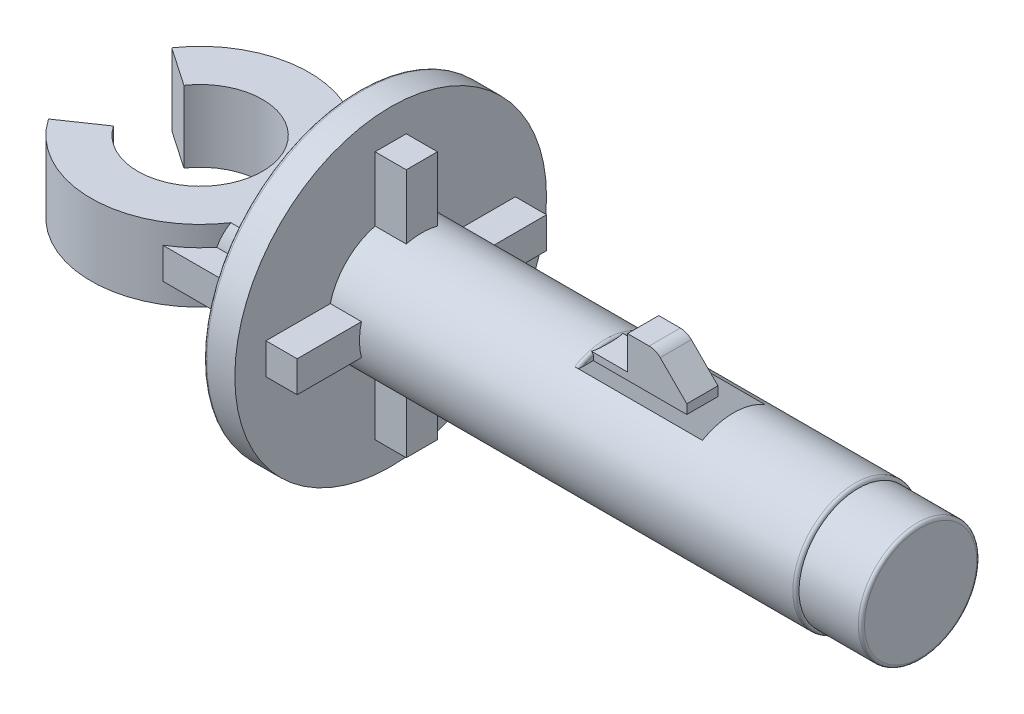
from build123d import *

# Parameters (mm, degrees)
SCHIZZO1_R                    = 2
ESTRUSIONE_ESTRUSIONE1_DEPTH  = 17
SCHIZZO2_OUTSIDE_W            = 9.584
SCHIZZO2_OUTSIDE_H            = 9.584
SCHIZZO2_OUTSIDE_R            = 1.9
TAGLIO_ESTRUSIONE1_DEPTH      = 2
SCHIZZO6_W                    = 15
SCHIZZO6_H                    = 4
TAGLIO_ESTRUSIONE3_DEPTH      = 0.1
TAGLIO_ESTRUSIONE4_DEPTH      = 1.7
TAGLIO_ESTRUSIONE4_DEPTH_BACK = 18.23368794
SCHIZZO5_W                    = 13
SCHIZZO5_H                    = 2
SCHIZZO7_W                    = 4
SCHIZZO7_H                    = 2
TAGLIO_ESTRUSIONE5_DEPTH      = 18.555910686
ESTRUSIONE_ESTRUSIONE2_DEPTH  = 0.5
TAGLIO_ESTRUSIONE6_DEPTH      = 0.07
ESTRUSIONE_ESTRUSIONE4_DEPTH  = 0.5
ESTRUSIONE_ESTRUSIONE5_DEPTH  = 0.5
SCHIZZO20_R                   = 5
ESTRUSIONE_ESTRUSIONE6_DEPTH  = 1
SCHIZZO23_R                   = 2.25
ESTRUSIONE_ESTRUSIONE7_DEPTH  = 3
ESTRUSIONE_ESTRUSIONE10_DEPTH = 1.15
ESTRUSIONE_ESTRUSIONE8_DEPTH  = 0.5
SCHIZZO35_W                   = 3
SCHIZZO35_H                   = 3.867815922
TAGLIO_ESTRUSIONE7_DEPTH      = 1.3
RACCORDO22_R                  = 0.5
RACCORDO23_R                  = 0.1
RACCORDO24_R                  = 0.1
RACCORDO25_R                  = 0.1
RACCORDO28_R                  = 0.1


# Some blends are built 0.0001 mm under size
with BuildPart() as part:
    # Schizzo1 → Estrusione-Estrusione1 (new body)
    with BuildSketch(Plane(origin=(0, 0, 0), x_dir=(0, 0, -1), z_dir=(1, 0, 0))):
        Circle(SCHIZZO1_R)
    extrude(amount=-ESTRUSIONE_ESTRUSIONE1_DEPTH)

    # Schizzo2 outside → Taglio-Estrusione1 (cut)
    with BuildSketch(Plane(origin=(0, 0, 0), x_dir=(0, 0, -1), z_dir=(1, 0, 0))):
        Rectangle(SCHIZZO2_OUTSIDE_W, SCHIZZO2_OUTSIDE_H)
        Circle(SCHIZZO2_OUTSIDE_R, mode=Mode.SUBTRACT)
    extrude(amount=-TAGLIO_ESTRUSIONE1_DEPTH, mode=Mode.SUBTRACT)

    # Schizzo6 → Taglio-Estrusione3 (cut)
    with BuildSketch(Plane(origin=(0, -2, 0), x_dir=(-1, 0, 0), z_dir=(0, -1, 0))):
        with Locations((9.5, 0)):
            Rectangle(SCHIZZO6_W, SCHIZZO6_H)
    extrude(amount=-TAGLIO_ESTRUSIONE3_DEPTH, mode=Mode.SUBTRACT)

    # Schizzo5 → Taglio-Estrusione4 (cut, two sides: drawn at the far end of the back side and taken through both)
    with BuildSketch(Plane(origin=(0, 0, 0), x_dir=(1, 0, 0), z_dir=(0, 1, 0)).offset(-TAGLIO_ESTRUSIONE4_DEPTH_BACK)):
        with Locations((-9.5, 0)):
            Rectangle(SCHIZZO5_W, SCHIZZO5_H)
    extrude(amount=TAGLIO_ESTRUSIONE4_DEPTH + TAGLIO_ESTRUSIONE4_DEPTH_BACK, mode=Mode.SUBTRACT)

    # Schizzo7 → Taglio-Estrusione5 (cut, through all)
    with BuildSketch(Plane(origin=(0, 2, 0), x_dir=(1, 0, 0), z_dir=(0, 1, 0))):
        with Locations((-8, 0)):
            Rectangle(SCHIZZO7_W, SCHIZZO7_H)
    extrude(amount=-TAGLIO_ESTRUSIONE5_DEPTH, mode=Mode.SUBTRACT)

    # Schizzo12 → Estrusione-Estrusione2 (add, symmetric)
    with BuildSketch(Plane.XY):
        Polygon((-10, 2), (-8.9, 2), (-8.9, 3), (-8, 3), (-7, 2), (-7, 1.7), (-10, 1.7), align=None)
    extrude(amount=ESTRUSIONE_ESTRUSIONE2_DEPTH, both=True)

    # Schizzo16 → Taglio-Estrusione6 (cut)
    with BuildSketch(Plane(origin=(0, 2, 0), x_dir=(1, 0, 0), z_dir=(0, 1, 0))):
        Polygon((-8.9, 0.5), (-10, 0.5), (-10, 0), (-10, -0.5), (-8.9, -0.5), align=None)
    extrude(amount=-TAGLIO_ESTRUSIONE6_DEPTH, mode=Mode.SUBTRACT)

    # Schizzo17 → Estrusione-Estrusione4 (add, symmetric)
    with BuildSketch(Plane.XY):
        Polygon((-17, 4), (-16, 4), (-16, 0.047058824), (-17, 0.05), align=None)
    estrusione_estrusione4 = extrude(amount=ESTRUSIONE_ESTRUSIONE4_DEPTH, both=True)

    # Specchia2: Estrusione-Estrusione4 across plane
    add(estrusione_estrusione4.mirror(Plane.ZX))

    # Schizzo19 → Estrusione-Estrusione5 (add, symmetric)
    with BuildSketch(Plane(origin=(0, 0, 0), x_dir=(1, 0, 0), z_dir=(0, 1, 0))):
        Polygon((-17, 2), (-17, 0), (-16, 0), (-16, 2), (-16, 4), (-17, 4), align=None)
    estrusione_estrusione5 = extrude(amount=ESTRUSIONE_ESTRUSIONE5_DEPTH, both=True)

    # Specchia5: Estrusione-Estrusione5 across plane
    add(estrusione_estrusione5.mirror(Plane.XY))

    # Schizzo20 → Estrusione-Estrusione6 (add)
    with BuildSketch(Plane.ZY.offset(17)):
        Circle(SCHIZZO20_R)
    extrude(amount=ESTRUSIONE_ESTRUSIONE6_DEPTH)

    # Schizzo23 → Estrusione-Estrusione7 (add)
    with BuildSketch(Plane.ZY.offset(18)):
        Circle(SCHIZZO23_R)
    extrude(amount=ESTRUSIONE_ESTRUSIONE7_DEPTH)

    # Schizzo22 → Estrusione-Estrusione10 (add, symmetric)
    with BuildSketch(Plane(origin=(0, 0, 0), x_dir=(1, 0, 0), z_dir=(0, 1, 0))):
        with BuildLine():
            Line((-24.762298216, -1.129872594), (-26, -1.977277039))
            ThreePointArc((-26, -1.977277039), (-19.612029171, 0), (-26, 1.977277039))
            Line((-26, 1.977277039), (-24.762298216, 1.129872594))
            ThreePointArc((-24.762298216, 1.129872594), (-21.112029171, 0), (-24.762298216, -1.129872594))
        make_face()
    extrude(amount=ESTRUSIONE_ESTRUSIONE10_DEPTH, both=True)

    # Schizzo34 → Estrusione-Estrusione8 (add, symmetric)
    with BuildSketch(Plane(origin=(0, 0, 0), x_dir=(1, 0, 0), z_dir=(0, 1, 0))):
        Polygon((-18, 3), (-21.309253533, 3), (-18, 0), align=None)
    estrusione_estrusione8 = extrude(amount=ESTRUSIONE_ESTRUSIONE8_DEPTH, both=True)

    # Specchia6: Estrusione-Estrusione8 across plane
    add(estrusione_estrusione8.mirror(Plane.XY))

    # Schizzo35 → Taglio-Estrusione7 (cut)
    with BuildSketch(Plane(origin=(0, 1.15, 0), x_dir=(1, 0, 0), z_dir=(0, 1, 0))):
        with Locations((-19.5, 0)):
            Rectangle(SCHIZZO35_W, SCHIZZO35_H)
    taglio_estrusione7 = extrude(amount=TAGLIO_ESTRUSIONE7_DEPTH, mode=Mode.SUBTRACT)

    # Specchia7: Taglio-Estrusione7 across plane
    add(taglio_estrusione7.mirror(Plane.ZX), mode=Mode.SUBTRACT)

    # Raccordo22
    raccordo22_edges = [part.edges().sort_by_distance(p)[0] for p in [
        (-8, 3, 0),
    ]]
    fillet(raccordo22_edges, radius=RACCORDO22_R)

    # Raccordo23
    raccordo23_edges = [part.edges().sort_by_distance(p)[0] for p in [
        (-2, 2, 0),
    ]]
    fillet(raccordo23_edges, radius=RACCORDO23_R - 0.0001)  # a hair under: the kernel refuses the full size

    # Raccordo24
    raccordo24_edges = [part.edges().sort_by_distance(p)[0] for p in [
        (0, 0, 1.9),
    ]]
    fillet(raccordo24_edges, radius=RACCORDO24_R)

    # Raccordo25
    raccordo25_edges = [part.edges().sort_by_distance(p)[0] for p in [
        (-18, 0, -5),
    ]]
    fillet(raccordo25_edges, radius=RACCORDO25_R)

    # Raccordo28
    # the kernel refuses this fillet: 0.1 mm, written as the material it takes off along each edge
    with BuildSketch(Plane(origin=(-10, 0, 0), x_dir=(0, 0.7969175395012055, 0.6040881022130338), z_dir=(0, -0.6040881022130338, 0.7969175395012055))) as raccordo28_piece_1_section:
        with BuildLine():
            CenterArc((2 - RACCORDO28_R, RACCORDO28_R), RACCORDO28_R, 270, 90)
            Line((2 - RACCORDO28_R, 0), (2, 0))
            Line((2, 0), (2, RACCORDO28_R))
        make_face()
    raccordo28_piece_1 = revolve(axis=Axis((-10, 0, 0), (-1, 0, 0)), revolution_arc=74.326501832, mode=Mode.PRIVATE)
    raccordo28_piece_1 = split(raccordo28_piece_1, bisect_by=Plane(origin=(-10.022414525, 1.819827674, 1), z_dir=(0, 0, -1)), keep=Keep.TOP, mode=Mode.PRIVATE)
    raccordo28_piece_1 = split(raccordo28_piece_1, bisect_by=Plane(origin=(-10.022414525, 1.819827674, 0.5), z_dir=(0, 0, 1)), keep=Keep.TOP, mode=Mode.PRIVATE)
    raccordo28_piece_1 = split(raccordo28_piece_1, bisect_by=Plane(origin=(-10.022414525, 1.93, 0.756995565), z_dir=(0, -1, 0)), keep=Keep.TOP, mode=Mode.PRIVATE)
    add(raccordo28_piece_1, mode=Mode.SUBTRACT)
    with BuildSketch(Plane(origin=(-10, 0, 0), x_dir=(0, 0.7969175395012055, 0.6040881022130338), z_dir=(0, -0.6040881022130338, 0.7969175395012055))) as raccordo28_piece_2_section:
        with BuildLine():
            CenterArc((2 - RACCORDO28_R, RACCORDO28_R), RACCORDO28_R, 270, 90)
            Line((2 - RACCORDO28_R, 0), (2, 0))
            Line((2, 0), (2, RACCORDO28_R))
        make_face()
    raccordo28_piece_2 = revolve(axis=Axis((-10, 0, 0), (-1, 0, 0)), revolution_arc=74.326501832, mode=Mode.PRIVATE)
    raccordo28_piece_2 = split(raccordo28_piece_2, bisect_by=Plane(origin=(-10.044225117, 1.932988234, 0.5), z_dir=(0, 0, 1)), keep=Keep.TOP, mode=Mode.PRIVATE)
    raccordo28_piece_2 = split(raccordo28_piece_2, bisect_by=Plane(origin=(-10.044225117, 1.93, 0.511192028), z_dir=(0, 1, 0)), keep=Keep.TOP, mode=Mode.PRIVATE)
    add(raccordo28_piece_2, mode=Mode.SUBTRACT)
    with BuildSketch(Plane(origin=(-10, 0, 0), x_dir=(0, 0.7969175395012055, 0.6040881022130338), z_dir=(0, -0.6040881022130338, 0.7969175395012055))) as raccordo28_piece_3_section:
        with BuildLine():
            CenterArc((2 - RACCORDO28_R, RACCORDO28_R), RACCORDO28_R, 270, 90)
            Line((2 - RACCORDO28_R, 0), (2, 0))
            Line((2, 0), (2, RACCORDO28_R))
        make_face()
    raccordo28_piece_3 = revolve(axis=Axis((-10, 0, 0), (-1, 0, 0)), revolution_arc=74.326501832, mode=Mode.PRIVATE)
    raccordo28_piece_3 = split(raccordo28_piece_3, bisect_by=Plane(origin=(-10.022414524, 1.819827674, -1), z_dir=(0, 0, 1)), keep=Keep.TOP, mode=Mode.PRIVATE)
    raccordo28_piece_3 = split(raccordo28_piece_3, bisect_by=Plane(origin=(-10.022414524, 1.93, -0.756995565), z_dir=(0, -1, 0)), keep=Keep.TOP, mode=Mode.PRIVATE)
    raccordo28_piece_3 = split(raccordo28_piece_3, bisect_by=Plane(origin=(-10.022414524, 1.819827674, -0.5), z_dir=(0, 0, -1)), keep=Keep.TOP, mode=Mode.PRIVATE)
    add(raccordo28_piece_3, mode=Mode.SUBTRACT)
    with BuildSketch(Plane(origin=(-10, 0, 0), x_dir=(0, 0.7969175395012055, 0.6040881022130338), z_dir=(0, -0.6040881022130338, 0.7969175395012055))) as raccordo28_piece_4_section:
        with BuildLine():
            CenterArc((2 - RACCORDO28_R, RACCORDO28_R), RACCORDO28_R, 270, 90)
            Line((2 - RACCORDO28_R, 0), (2, 0))
            Line((2, 0), (2, RACCORDO28_R))
        make_face()
    raccordo28_piece_4 = revolve(axis=Axis((-10, 0, 0), (-1, 0, 0)), revolution_arc=74.326501832, mode=Mode.PRIVATE)
    raccordo28_piece_4 = split(raccordo28_piece_4, bisect_by=Plane(origin=(-10.040080162, 1.981654904, 0.5), z_dir=(0, 0, -1)), keep=Keep.TOP, mode=Mode.PRIVATE)
    raccordo28_piece_4 = split(raccordo28_piece_4, bisect_by=Plane(origin=(-10.040080162, 1.93, 0), z_dir=(0, 1, 0)), keep=Keep.TOP, mode=Mode.PRIVATE)
    raccordo28_piece_4 = split(raccordo28_piece_4, bisect_by=Plane(origin=(-10.040080162, 1.981654904, -0.5), z_dir=(0, 0, 1)), keep=Keep.TOP, mode=Mode.PRIVATE)
    add(raccordo28_piece_4, mode=Mode.SUBTRACT)
    with BuildSketch(Plane(origin=(-10, 0, 0), x_dir=(0, 0.7969175395012055, 0.6040881022130338), z_dir=(0, -0.6040881022130338, 0.7969175395012055))) as raccordo28_piece_5_section:
        with BuildLine():
            CenterArc((2 - RACCORDO28_R, RACCORDO28_R), RACCORDO28_R, 270, 90)
            Line((2 - RACCORDO28_R, 0), (2, 0))
            Line((2, 0), (2, RACCORDO28_R))
        make_face()
    raccordo28_piece_5 = revolve(axis=Axis((-10, 0, 0), (-1, 0, 0)), revolution_arc=74.326501832, mode=Mode.PRIVATE)
    raccordo28_piece_5 = split(raccordo28_piece_5, bisect_by=Plane(origin=(-10.044225117, 1.93, -0.511192028), z_dir=(0, 1, 0)), keep=Keep.TOP, mode=Mode.PRIVATE)
    raccordo28_piece_5 = split(raccordo28_piece_5, bisect_by=Plane(origin=(-10.044225117, 1.932988234, -0.5), z_dir=(0, 0, -1)), keep=Keep.TOP, mode=Mode.PRIVATE)
    add(raccordo28_piece_5, mode=Mode.SUBTRACT)

    # Estrusione-Estrusione9 cone 1 section (through the dimple's axis) → Estrusione-Estrusione9 (revolve)
    with BuildSketch(Plane(origin=(-18, 0, 0), x_dir=(0, 0, -1), z_dir=(0, 1, 0))):
        Polygon((0, 0), (4.9, 0), (0, 0.864002205), align=None)
    revolve(axis=Axis((-18, 0, 0), (-1, 0, 0)))


solid = part.part
